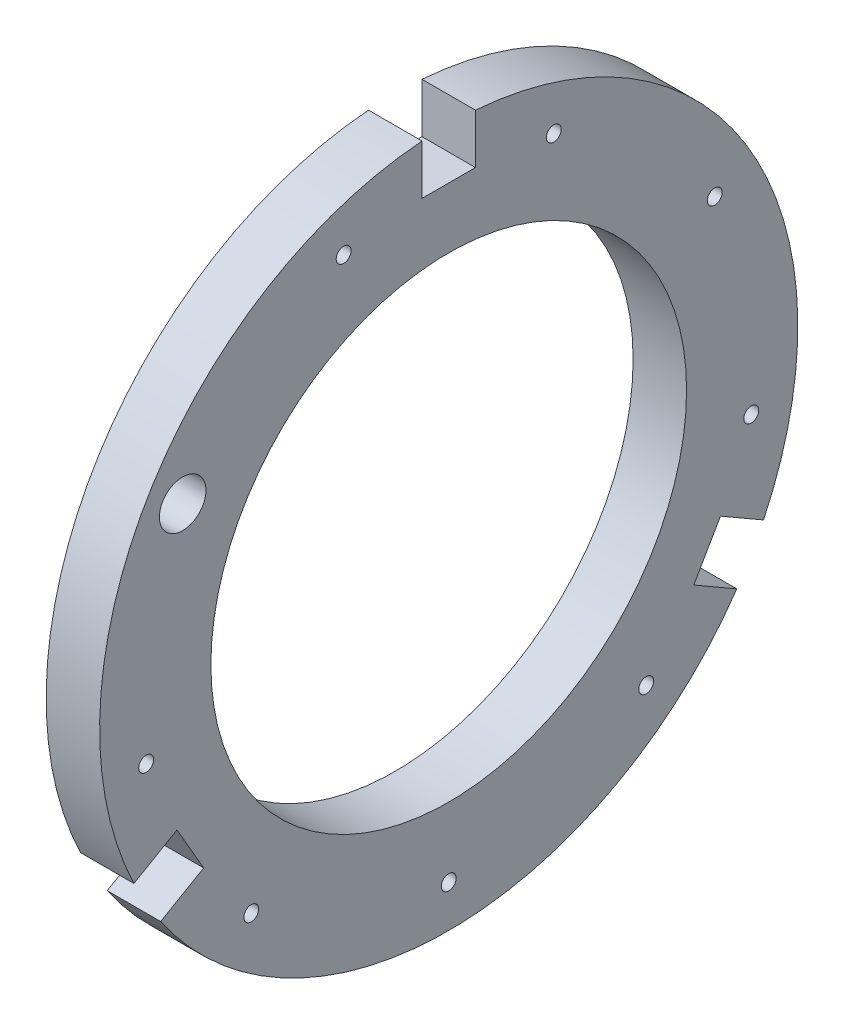
from build123d import *

# Parameters (mm, degrees)
ESQUISSE1_R                  = 51.1
BOSS_EXTRU_1_DEPTH           = 11.482
CUT_EXTRUDE1_DEPTH           = 107.685689406
CUT_EXTRUDE1_DEPTH_BACK      = 107.685689406
SKETCH1_R                    = 1.6
ENL_V_MAT_EXTRU_3_DEPTH      = 107.685689406
ENL_V_MAT_EXTRU_3_DEPTH_BACK = 107.685689406
ESQUISSE4_R                  = 5


with BuildPart() as part:
    # Esquisse1 → Boss.-Extru.1 (new body)
    with BuildSketch(Plane(origin=(0, 0, 0), x_dir=(0, 0, -1), z_dir=(1, 0, 0))):
        with BuildLine():
            Line((-5.741, 64.1), (-5.741, 74.77994998))
            ThreePointArc((-5.741, 74.77994998), (-64.951905284, 37.5), (-67.631836376, -32.418123147))
            Line((-67.631836376, -32.418123147), (-58.382728383, -27.078148157))
            Line((-58.382728383, -27.078148157), (-52.641728383, -37.021851843))
            Line((-52.641728383, -37.021851843), (-61.890836376, -42.361826833))
            ThreePointArc((-61.890836376, -42.361826833), (0, -75), (61.890836376, -42.361826833))
            Line((61.890836376, -42.361826833), (52.641728383, -37.021851843))
            Line((52.641728383, -37.021851843), (58.382728383, -27.078148157))
            Line((58.382728383, -27.078148157), (67.631836376, -32.418123147))
            ThreePointArc((67.631836376, -32.418123147), (64.951905284, 37.5), (5.741, 74.77994998))
            Line((5.741, 74.77994998), (5.741, 64.1))
            Line((5.741, 64.1), (-5.741, 64.1))
        make_face()
        Circle(ESQUISSE1_R, mode=Mode.SUBTRACT)
    extrude(amount=BOSS_EXTRU_1_DEPTH)

    # Sketch1 → Cut-Extrude1 (cut, two sides: drawn at the far end of the back side and taken through both)
    with BuildSketch(Plane(origin=(0, 0, 0), x_dir=(0, 0, -1), z_dir=(1, 0, 0)).offset(-CUT_EXTRUDE1_DEPTH_BACK)):
        with Locations((22.573329459, 62.019712972)):
            Circle(SKETCH1_R)
        with Locations((57.15767665, 33)):
            Circle(SKETCH1_R)
        with Locations((64.997311699, -11.460779726)):
            Circle(SKETCH1_R)
        with Locations((42.423982239, -50.558933246)):
            Circle(SKETCH1_R)
        with Locations((0, -66)):
            Circle(SKETCH1_R)
        with Locations((-42.423982239, -50.558933246)):
            Circle(SKETCH1_R)
        with Locations((-64.997311699, -11.460779726)):
            Circle(SKETCH1_R)
        with Locations((-57.15767665, 33)):
            Circle(SKETCH1_R)
        with Locations((-22.573329459, 62.019712972)):
            Circle(SKETCH1_R)
    extrude(amount=CUT_EXTRUDE1_DEPTH + CUT_EXTRUDE1_DEPTH_BACK, mode=Mode.SUBTRACT)

    # Esquisse4 → Enlèv. mat.-Extru.3 (cut, two sides: drawn at the far end of the back side and taken through both)
    with BuildSketch(Plane(origin=(0, 0, 0), x_dir=(0, 0, -1), z_dir=(1, 0, 0)).offset(-ENL_V_MAT_EXTRU_3_DEPTH_BACK)):
        with Locations((-57.15767665, 33)):
            Circle(ESQUISSE4_R)
    extrude(amount=ENL_V_MAT_EXTRU_3_DEPTH + ENL_V_MAT_EXTRU_3_DEPTH_BACK, mode=Mode.SUBTRACT)


solid = part.part
